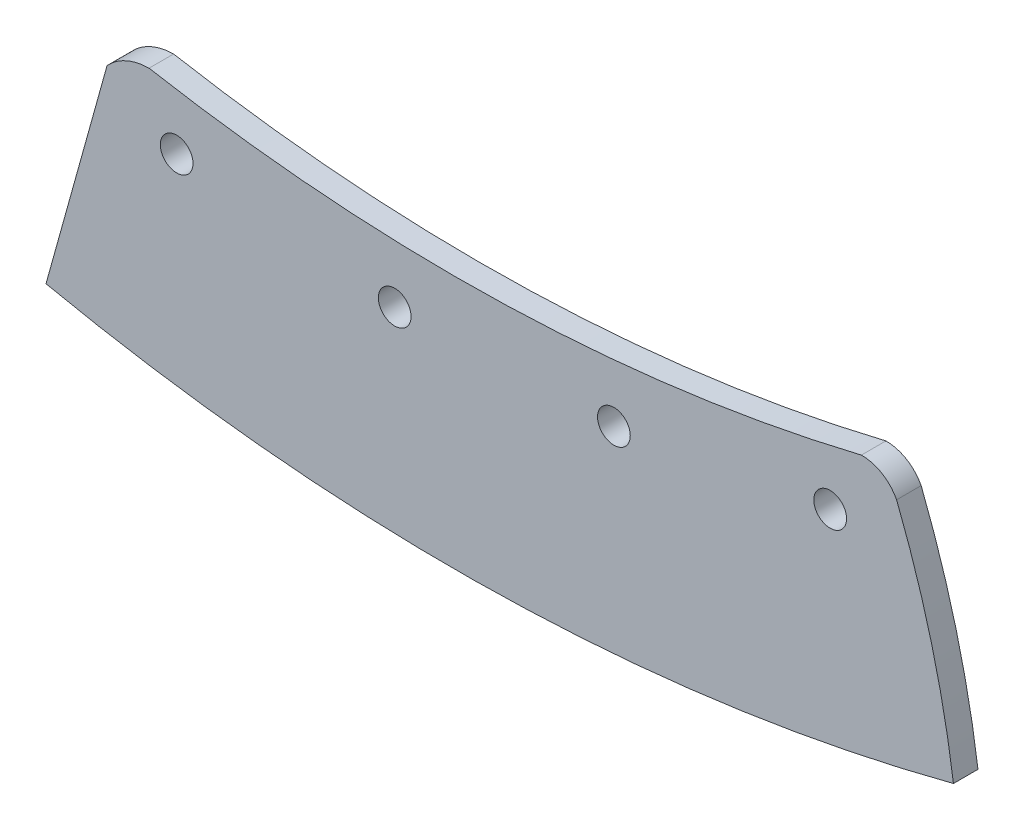
from build123d import *

# Parameters (mm, degrees)
IZIM1_R            = 10
TABAN_FLAN_1_DEPTH = 15


# Sheet-metal steps are written as plain solids
with BuildPart() as part:
    # Çizim1 → Taban-Flanş1 (new body)
    with BuildSketch(Plane.XY):
        with BuildLine():
            Line((-154.698643159, 156.857538138), (-192.024974986, 22.709348381))
            ThreePointArc((-192.024974986, 22.709348381), (85.964362875, -3.168316981), (362.465125286, 35.497610073))
            ThreePointArc((362.465125286, 35.497610073), (349.092339052, 102.938005803), (327.738170112, 168.291183666))
            ThreePointArc((327.738170112, 168.291183666), (318.781629996, 177.759788443), (306.201680975, 181.168449454))
            ThreePointArc((306.201680975, 181.168449454), (89.247279864, 151.970973974), (-129.053786306, 168.291183666))
            ThreePointArc((-129.053786306, 168.291183666), (-143.060537772, 165.230713571), (-154.698643159, 156.857538138))
        make_face()
        with Locations((-112.183904076, 131.277032831)):
            Circle(IZIM1_R, mode=Mode.SUBTRACT)
        with Locations((21.040997306, 116.885172221)):
            Circle(IZIM1_R, mode=Mode.SUBTRACT)
        with Locations((154.983782422, 120.800566875)):
            Circle(IZIM1_R, mode=Mode.SUBTRACT)
        with Locations((287.140513745, 142.950022083)):
            Circle(IZIM1_R, mode=Mode.SUBTRACT)
    extrude(amount=-TABAN_FLAN_1_DEPTH)


solid = part.part
